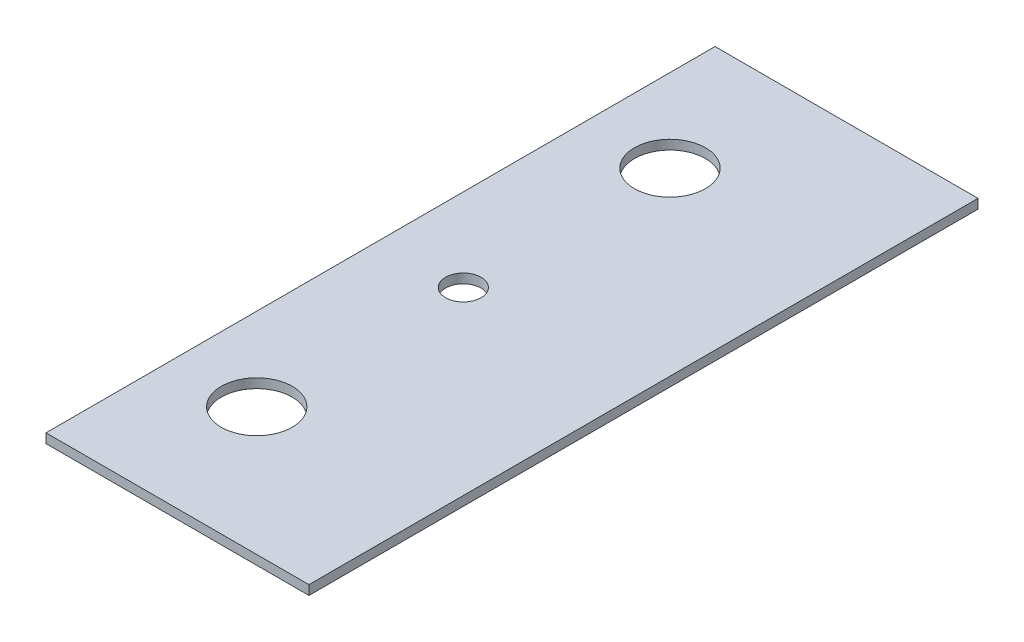
from build123d import *

# Parameters (mm, degrees)
SKETCH1_W           = 22.225
SKETCH1_H           = 56.55
SKETCH1_R           = 1.5
SKETCH1_R_2         = 3
BOSS_EXTRUDE1_DEPTH = 0.79375


with BuildPart() as part:
    # Sketch1 → Boss-Extrude1 (new body)
    with BuildSketch(Plane(origin=(0, 0, 0), x_dir=(1, 0, 0), z_dir=(0, 1, 0))):
        with Locations((93.614649254, -89.26803402)):
            Rectangle(SKETCH1_W, SKETCH1_H)
        with Locations((89.502149254, -89.26803402)):
            Circle(SKETCH1_R, mode=Mode.SUBTRACT)
        with Locations((89.502149254, -71.80553402)):
            Circle(SKETCH1_R_2, mode=Mode.SUBTRACT)
        with Locations((89.502149254, -106.73053402)):
            Circle(SKETCH1_R_2, mode=Mode.SUBTRACT)
    extrude(amount=BOSS_EXTRUDE1_DEPTH)


solid = part.part
